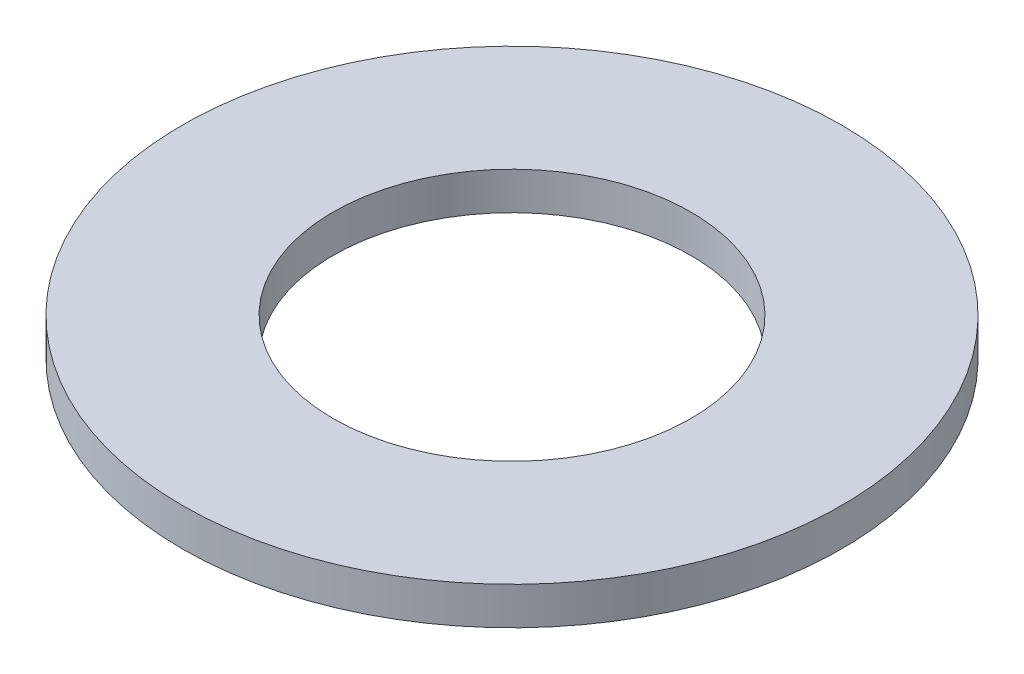
from build123d import *

# Parameters (mm, degrees)
SKETCH1_R           = 87.5
BOSS_EXTRUDE1_DEPTH = 10
SKETCH2_R           = 47.5
CUT_EXTRUDE1_DEPTH  = 125.147090179


with BuildPart() as part:
    # Sketch1 → Boss-Extrude1 (new body)
    with BuildSketch(Plane(origin=(0, 0, 0), x_dir=(1, 0, 0), z_dir=(0, 1, 0))):
        Circle(SKETCH1_R)
    extrude(amount=BOSS_EXTRUDE1_DEPTH)

    # Sketch2 → Cut-Extrude1 (cut, through all)
    with BuildSketch(Plane(origin=(0, 0, 0), x_dir=(1, 0, 0), z_dir=(0, 1, 0))):
        Circle(SKETCH2_R)
    extrude(amount=CUT_EXTRUDE1_DEPTH, mode=Mode.SUBTRACT)


solid = part.part
